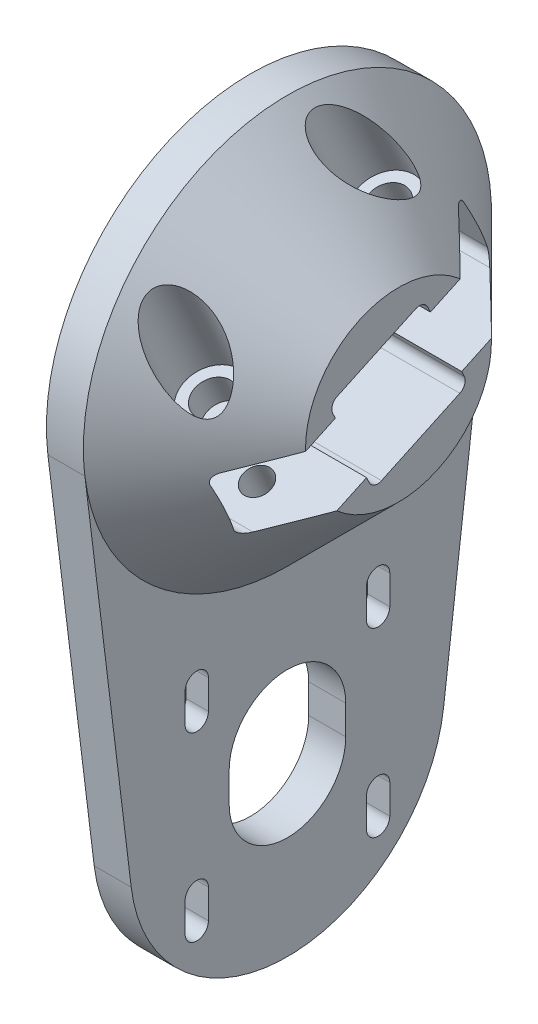
from build123d import *

# Parameters (mm, degrees)
BOSS_EXTRUDE1_DEPTH = 6.35
SKETCH20_R          = 35
BOSS_EXTRUDE5_DEPTH = 19.05
CUT_EXTRUDE14_DEPTH = 103.562956276
CHAMFER1_SIZE       = 19.05
SKETCH22_R          = 3.175
CUT_EXTRUDE15_DEPTH = 109.709596838
SKETCH24_R          = 5
CUT_EXTRUDE16_DEPTH = 114.565219549
SKETCH25_R          = 2.38125
CUT_EXTRUDE17_DEPTH = 10
CUT_EXTRUDE18_DEPTH = 10
CHAMFER2_SIZE       = 2.5
FILLET1_R           = 1.5875


with BuildPart() as part:
    # Sketch1 → Boss-Extrude1 (new body)
    with BuildSketch(Plane(origin=(0, 0, 0), x_dir=(0, 0, -1), z_dir=(1, 0, 0))):
        with BuildLine():
            Line((-34.741931963, -4.242424242), (-26.800918943, -69.272727273))
            ThreePointArc((-26.800918943, -69.272727273), (0, -93), (26.800918943, -69.272727273))
            Line((26.800918943, -69.272727273), (34.741931963, -4.242424242))
            ThreePointArc((34.741931963, -4.242424242), (0, 35), (-34.741931963, -4.242424242))
        make_face()
        Polygon((4.353205728, 11.960334439), (-11.960334439, 4.353205728), (-4.353205728, -11.960334439), (11.960334439, -4.353205728), align=None, mode=Mode.SUBTRACT)
    extrude(amount=BOSS_EXTRUDE1_DEPTH)

    # Sketch20 → Boss-Extrude5 (add)
    with BuildSketch(Plane(origin=(6.35, 0, 0), x_dir=(0, 0, -1), z_dir=(1, 0, 0))):
        with Locations(Location((0, 0, 0), (0, 0, 186.962062691))):
            Circle(SKETCH20_R)
    extrude(amount=BOSS_EXTRUDE5_DEPTH)

    # Sketch21 → Cut-Extrude14 (cut, through all)
    with BuildSketch(Plane.ZY):
        Polygon((-19.067760927, 15.897892729), (-24.435012851, 4.387783834), (-10.840396045, -1.951490092), (-5.473144121, 9.558618803), align=None)
        Polygon((-11.960334439, -4.353205728), (-4.353205728, 11.960334439), (11.960334439, 4.353205728), (4.353205728, -11.960334439), align=None)
        Polygon((10.840396045, 1.951490092), (5.473144121, -9.558618803), (19.067760927, -15.897892729), (24.435012851, -4.387783834), align=None)
    extrude(amount=-CUT_EXTRUDE14_DEPTH, mode=Mode.SUBTRACT)

    # Chamfer1
    # the kernel refuses this chamfer: 19.05 mm, written as the material it takes off along each edge
    with BuildSketch(Plane(origin=(25.4, 0, 0), x_dir=(0, -0.1212121212106579, 0.9926266275249788), z_dir=(0, 0.9926266275249788, 0.1212121212106579))) as chamfer1_piece_1:
        Polygon((35, -CHAMFER1_SIZE), (35 - CHAMFER1_SIZE, 0), (35, 0), align=None)
    revolve(axis=Axis((25.4, 0, 0), (1, 0, 0)), mode=Mode.SUBTRACT)

    # Sketch22 → Cut-Extrude15 (cut, through all)
    with BuildSketch(Plane(origin=(0, 5.755054448, 2.683625962), x_dir=(-1, 0, 0), z_dir=(0, -0.9063077870366495, -0.4226182617407006))):
        with Locations(Location((-13.4, -16.5, 0), (0, 0, 90))):
            Circle(SKETCH22_R)
    cut_extrude15 = extrude(amount=-CUT_EXTRUDE15_DEPTH, mode=Mode.SUBTRACT)

    # Sketch24 → Cut-Extrude16 (cut, through all)
    with BuildSketch(Plane(origin=(0, 10.286593383, 4.796717271), x_dir=(-1, 0, 0), z_dir=(0, -0.9063077870366495, -0.4226182617407006))):
        with Locations(Location((-13.4, -16.5, 0), (0, 0, 90))):
            Circle(SKETCH24_R)
    cut_extrude16 = extrude(amount=-CUT_EXTRUDE16_DEPTH, mode=Mode.SUBTRACT)

    # Sketch25 → Cut-Extrude17 (cut)
    with BuildSketch(Plane(origin=(0, -5.755054448, -2.683625962), x_dir=(1, 0, 0), z_dir=(0, 0.9063077870366495, 0.4226182617407006))):
        with Locations(Location((13.4, -16.5, 0), (0, 0, 270))):
            Circle(SKETCH25_R)
    cut_extrude17 = extrude(amount=-CUT_EXTRUDE17_DEPTH, mode=Mode.SUBTRACT)

    # Mirror1: Cut-Extrude15, Cut-Extrude16, Cut-Extrude17 across plane
    add(cut_extrude15.mirror(Plane(origin=(0, 0, 0), x_dir=(1, 0, 0), z_dir=(0, 0.422618261740701, -0.9063077870366492))), mode=Mode.SUBTRACT)
    add(cut_extrude16.mirror(Plane(origin=(0, 0, 0), x_dir=(1, 0, 0), z_dir=(0, 0.422618261740701, -0.9063077870366492))), mode=Mode.SUBTRACT)
    add(cut_extrude17.mirror(Plane(origin=(0, 0, 0), x_dir=(1, 0, 0), z_dir=(0, 0.422618261740701, -0.9063077870366492))), mode=Mode.SUBTRACT)

    # Sketch19 → Cut-Extrude18 (cut)
    with BuildSketch(Plane(origin=(6.35, 0, 0), x_dir=(0, 0, -1), z_dir=(1, 0, 0))):
        with BuildLine():
            Line((13.556349186, -44.768650814), (13.556349186, -49.768650814))
            ThreePointArc((13.556349186, -49.768650814), (15.556349186, -51.768650814), (17.556349186, -49.768650814))
            Line((17.556349186, -49.768650814), (17.556349186, -44.768650814))
            ThreePointArc((17.556349186, -44.768650814), (15.556349186, -42.768650814), (13.556349186, -44.768650814))
        make_face()
        with BuildLine():
            Line((-10, -60.325), (-10, -65.325))
            ThreePointArc((-10, -65.325), (0, -75.325), (10, -65.325))
            Line((10, -65.325), (10, -60.325))
            ThreePointArc((10, -60.325), (0, -50.325), (-10, -60.325))
        make_face()
        with BuildLine():
            Line((17.556349186, -80.881349186), (17.556349186, -75.881349186))
            ThreePointArc((17.556349186, -75.881349186), (15.556349186, -73.881349186), (13.556349186, -75.881349186))
            Line((13.556349186, -75.881349186), (13.556349186, -80.881349186))
            ThreePointArc((13.556349186, -80.881349186), (15.556349186, -82.881349186), (17.556349186, -80.881349186))
        make_face()
        with BuildLine():
            Line((-17.556349186, -44.768650814), (-17.556349186, -49.768650814))
            ThreePointArc((-17.556349186, -49.768650814), (-15.556349186, -51.768650814), (-13.556349186, -49.768650814))
            Line((-13.556349186, -49.768650814), (-13.556349186, -44.768650814))
            ThreePointArc((-13.556349186, -44.768650814), (-15.556349186, -42.768650814), (-17.556349186, -44.768650814))
        make_face()
        with BuildLine():
            Line((-13.556349186, -80.881349186), (-13.556349186, -75.881349186))
            ThreePointArc((-13.556349186, -75.881349186), (-15.556349186, -73.881349186), (-17.556349186, -75.881349186))
            Line((-17.556349186, -75.881349186), (-17.556349186, -80.881349186))
            ThreePointArc((-17.556349186, -80.881349186), (-15.556349186, -82.881349186), (-13.556349186, -80.881349186))
        make_face()
    extrude(amount=-CUT_EXTRUDE18_DEPTH, mode=Mode.SUBTRACT)


with BuildPart() as body_2:
    # Mirror2: mirrored copy
    add(part.part.mirror(Plane(origin=(0, 0, 0), x_dir=(0, 0, 1), z_dir=(1, 0, 0))))


with BuildPart() as part_1:
    add(part.part)

    # Chamfer2
    chamfer2_edges = [part_1.edges().sort_by_distance(p)[0] for p in [
        (0, -47.268650814, 13.556349186),
        (0, -42.768650814, 15.556349186),
        (0, -47.268650814, 17.556349186),
        (0, -51.768650814, 15.556349186),
        (0, -47.268650814, -17.556349186),
        (0, -42.768650814, -15.556349186),
        (0, -47.268650814, -13.556349186),
        (0, -51.768650814, -15.556349186),
    ]]
    chamfer(chamfer2_edges, length=CHAMFER2_SIZE)

    # Fillet1
    fillet1_edges = [part_1.edges().sort_by_distance(p)[0] for p in [
        (12.7, -4.353205728, -11.960334439),
        (8.262078305, 4.387783834, -24.435012851),
        (12.7, 11.960334439, -4.353205728),
        (8.262078305, 15.897892729, -19.067760927),
        (8.262078305, -4.387783834, 24.435012851),
        (12.7, 4.353205728, 11.960334439),
        (12.7, -11.960334439, 4.353205728),
        (8.262078305, -15.897892729, 19.067760927),
    ]]
    fillet(fillet1_edges, radius=FILLET1_R)


solid = part_1.part
